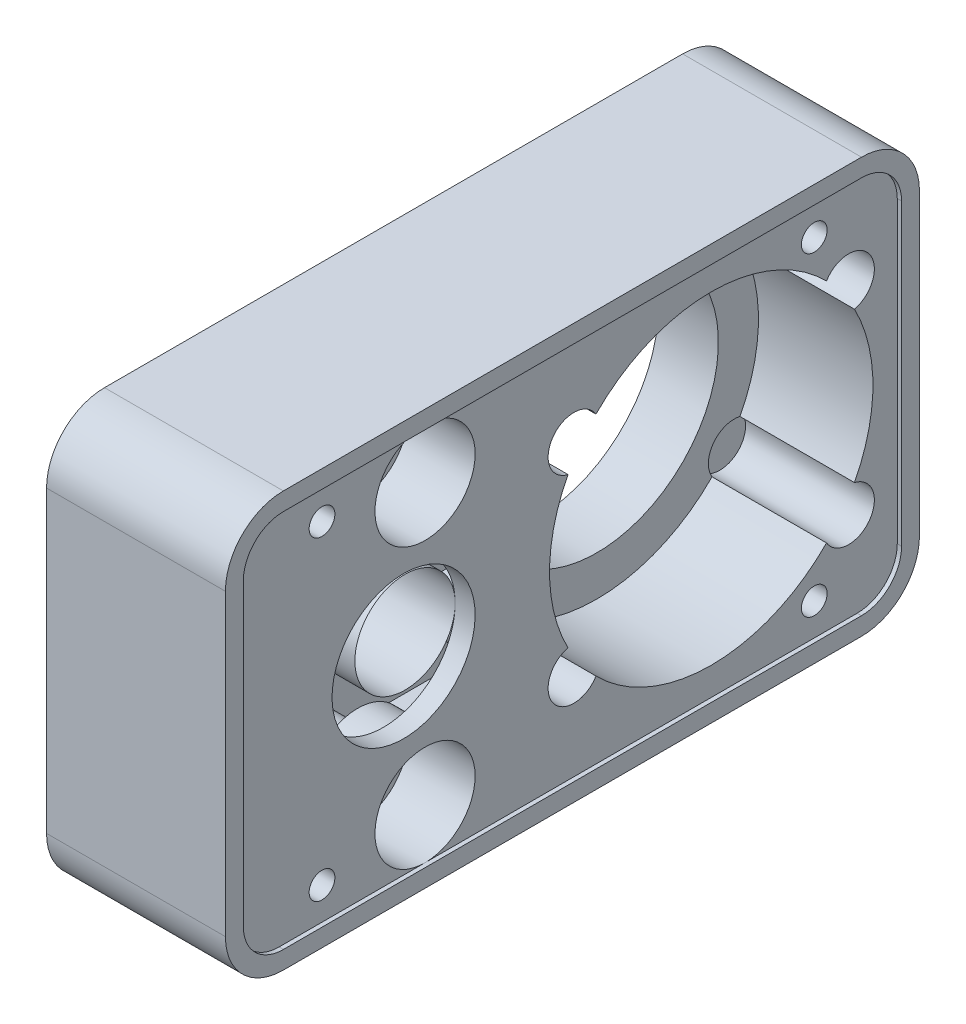
from build123d import *

# Parameters (mm, degrees)
SKETCH1_R             = 10.795
BOSS_EXTRUDE1_DEPTH   = 15.875
CAVITY1_START         = 5.334
CAVITY1_OUTLINE_R     = 1.143
CAVITY1_OUTLINE_R_2   = 4.445
CAVITY1_OUTLINE_R_3   = 10.795
CAVITY1_DEPTH         = 10.541
CAVITY1_START_2       = 15.494
CAVITY1_2_OUTLINE_R   = 1.143
CAVITY1_2_OUTLINE_R_2 = 4.445
CAVITY1_2_DEPTH       = 0.381
CAVITY1_START_3       = 2.286
CAVITY1_3_OUTLINE_R   = 1.143
CAVITY1_3_OUTLINE_R_2 = 4.445
CAVITY1_3_DEPTH       = 3.048
CAVITY1_4_OUTLINE_R   = 1.905
CAVITY1_4_DEPTH       = 3.302
CAVITY1_START_4       = 13.716
CAVITY1_5_DEPTH       = 1.778
CAVITY1_START_5       = 4.064
CAVITY1_6_OUTLINE_R   = 2.286
CAVITY1_6_DEPTH       = 1.27
CAVITY1_START_6       = 2.032
CAVITY1_7_DEPTH       = 0.254
CUT_EXTRUDE1_REACH    = 51.711
SKETCH2_R             = 2.286
SKETCH3_R             = 4.445
CUT_EXTRUDE2_DEPTH    = 5.969


# Read off the part's stored shape, not the designer's step: Cavity1
with BuildPart() as part:
    # Sketch1 → Boss-Extrude1 (new body)
    with BuildSketch(Plane(origin=(0, 0, 0), x_dir=(0, 0, -1), z_dir=(1, 0, 0))):
        with BuildLine():
            Line((12.954, 18.415), (-38.354, 18.415))
            ThreePointArc((-38.354, 18.415), (-41.991003729, 16.908503729), (-43.4975, 13.2715))
            Line((-43.4975, 13.2715), (-43.4975, -13.2715))
            ThreePointArc((-43.4975, -13.2715), (-41.991003729, -16.908503729), (-38.354, -18.415))
            Line((-38.354, -18.415), (12.954, -18.415))
            ThreePointArc((12.954, -18.415), (16.591003729, -16.908503729), (18.0975, -13.2715))
            Line((18.0975, -13.2715), (18.0975, 13.2715))
            ThreePointArc((18.0975, 13.2715), (16.591003729, 16.908503729), (12.954, 18.415))
        make_face()
        Circle(SKETCH1_R, mode=Mode.SUBTRACT)
    extrude(amount=BOSS_EXTRUDE1_DEPTH)

    # Cavity1 outline → Cavity1 (cut)
    # profile 1 of 6: a face of its own
    with BuildSketch(Plane.YZ.offset(CAVITY1_START)):
        with Locations((13.97, 34.544)):
            Circle(CAVITY1_OUTLINE_R)
    # profile 2 of 6: a face of its own
    with BuildSketch(Plane.YZ.offset(CAVITY1_START)):
        with Locations((0, 25.4)):
            Circle(CAVITY1_OUTLINE_R_2)
    # profile 3 of 6: a face of its own
    with BuildSketch(Plane.YZ.offset(CAVITY1_START)):
        with BuildLine():
            ThreePointArc((6.663505747, 12.710188518), (0, 14.351), (-6.663505747, 12.710188518))
            ThreePointArc((-6.663505747, 12.710188518), (-10.236847552, 14.039105214), (-10.064128852, 10.230567504))
            ThreePointArc((-10.064128852, 10.230567504), (-14.351, 0), (-10.064128852, -10.230567504))
            ThreePointArc((-10.064128852, -10.230567504), (-10.236847552, -14.039105214), (-6.663505747, -12.710188518))
            ThreePointArc((-6.663505747, -12.710188518), (0, -14.351), (6.663505747, -12.710188518))
            ThreePointArc((6.663505747, -12.710188518), (10.236847552, -14.039105214), (10.064128852, -10.230567504))
            ThreePointArc((10.064128852, -10.230567504), (14.351, 0), (10.064128852, 10.230567504))
            ThreePointArc((10.064128852, 10.230567504), (10.236847552, 14.039105214), (6.663505747, 12.710188518))
        make_face()
        Circle(CAVITY1_OUTLINE_R_3, mode=Mode.SUBTRACT)
    # profile 4 of 6: a face of its own
    with BuildSketch(Plane.YZ.offset(CAVITY1_START)):
        with Locations((13.97, -9.144)):
            Circle(CAVITY1_OUTLINE_R)
    # profile 5 of 6: a face of its own
    with BuildSketch(Plane.YZ.offset(CAVITY1_START)):
        with Locations((-13.97, 34.544)):
            Circle(CAVITY1_OUTLINE_R)
    # profile 6 of 6: a face of its own
    with BuildSketch(Plane.YZ.offset(CAVITY1_START)):
        with Locations((-13.97, -9.144)):
            Circle(CAVITY1_OUTLINE_R)
    extrude(amount=CAVITY1_DEPTH, mode=Mode.SUBTRACT)

    # Cavity1 2 outline → Cavity1 2 (cut)
    with BuildSketch(Plane.YZ.offset(CAVITY1_START_2)):
        with BuildLine():
            ThreePointArc((16.8275, 38.354), (15.785971714, 40.868471714), (13.2715, 41.91))
            Line((13.2715, 41.91), (-13.2715, 41.91))
            ThreePointArc((-13.2715, 41.91), (-15.785971714, 40.868471714), (-16.8275, 38.354))
            Line((-16.8275, 38.354), (-16.8275, -12.954))
            ThreePointArc((-16.8275, -12.954), (-15.785971714, -15.468471714), (-13.2715, -16.51))
            Line((-13.2715, -16.51), (13.2715, -16.51))
            ThreePointArc((13.2715, -16.51), (15.785971714, -15.468471714), (16.8275, -12.954))
            Line((16.8275, -12.954), (16.8275, 38.354))
        make_face()
        with Locations((13.97, 34.544)):
            Circle(CAVITY1_2_OUTLINE_R, mode=Mode.SUBTRACT)
        with BuildLine():
            ThreePointArc((10.064128852, 10.230567504), (14.351, 0), (10.064128852, -10.230567504))
            ThreePointArc((10.064128852, -10.230567504), (10.236847552, -14.039105214), (6.663505747, -12.710188518))
            ThreePointArc((6.663505747, -12.710188518), (0, -14.351), (-6.663505747, -12.710188518))
            ThreePointArc((-6.663505747, -12.710188518), (-10.236847552, -14.039105214), (-10.064128852, -10.230567504))
            ThreePointArc((-10.064128852, -10.230567504), (-14.351, 0), (-10.064128852, 10.230567504))
            ThreePointArc((-10.064128852, 10.230567504), (-10.236847552, 14.039105214), (-6.663505747, 12.710188518))
            ThreePointArc((-6.663505747, 12.710188518), (0, 14.351), (6.663505747, 12.710188518))
            ThreePointArc((6.663505747, 12.710188518), (10.236847552, 14.039105214), (10.064128852, 10.230567504))
        make_face(mode=Mode.SUBTRACT)
        with Locations((0, 25.4)):
            Circle(CAVITY1_2_OUTLINE_R_2, mode=Mode.SUBTRACT)
        with Locations((13.97, -9.144)):
            Circle(CAVITY1_2_OUTLINE_R, mode=Mode.SUBTRACT)
        with Locations((-13.97, 34.544)):
            Circle(CAVITY1_2_OUTLINE_R, mode=Mode.SUBTRACT)
        with Locations((-13.97, -9.144)):
            Circle(CAVITY1_2_OUTLINE_R, mode=Mode.SUBTRACT)
    extrude(amount=CAVITY1_2_DEPTH, mode=Mode.SUBTRACT)

    # Cavity1 3 outline → Cavity1 3 (cut)
    with BuildSketch(Plane.YZ.offset(CAVITY1_START_3)):
        with Locations((13.97, 34.544)):
            Circle(CAVITY1_3_OUTLINE_R)
        with Locations((0, 25.4)):
            Circle(CAVITY1_3_OUTLINE_R_2)
        with BuildLine():
            ThreePointArc((3.011692939, 10.366375), (3.7542861, 12.050819068), (3.62043784, 13.886815))
            ThreePointArc((3.62043784, 13.886815), (0, 14.351), (-3.62043784, 13.886815))
            ThreePointArc((-3.62043784, 13.886815), (-3.7542861, 12.050819068), (-3.011692939, 10.366375))
            ThreePointArc((-3.011692939, 10.366375), (0, 10.795), (3.011692939, 10.366375))
        make_face()
        with Locations((13.97, -9.144)):
            Circle(CAVITY1_3_OUTLINE_R)
        with Locations((-13.97, 34.544)):
            Circle(CAVITY1_3_OUTLINE_R)
        with Locations((-13.97, -9.144)):
            Circle(CAVITY1_3_OUTLINE_R)
    extrude(amount=CAVITY1_3_DEPTH, mode=Mode.SUBTRACT)

    # Cavity1 4 outline → Cavity1 4 (cut)
    with BuildSketch(Plane.YZ):
        with Locations((13.97, 34.544)):
            Circle(CAVITY1_4_OUTLINE_R)
        with Locations((13.97, -9.144)):
            Circle(CAVITY1_4_OUTLINE_R)
        with Locations((-13.97, 34.544)):
            Circle(CAVITY1_4_OUTLINE_R)
        with Locations((-13.97, -9.144)):
            Circle(CAVITY1_4_OUTLINE_R)
    extrude(amount=CAVITY1_4_DEPTH, mode=Mode.SUBTRACT)

    # Cavity1 5 outline → Cavity1 5 (cut)
    with BuildSketch(Plane.YZ.offset(CAVITY1_START_4)):
        with BuildLine():
            Line((4.32851275, 24.389058668), (6.269761763, 26.298725967))
            ThreePointArc((6.269761763, 26.298725967), (6.329908656, 26.800266009), (6.35, 27.305))
            ThreePointArc((6.35, 27.305), (5.350674614, 30.724470892), (2.667234274, 33.067669635))
            Line((2.667234274, 33.067669635), (1.522653349, 29.576068938))
            ThreePointArc((1.522653349, 29.576068938), (3.641855237, 27.948512396), (4.445, 25.4))
            ThreePointArc((4.445, 25.4), (4.41578216, 24.891184794), (4.32851275, 24.389058668))
        make_face()
        with BuildLine():
            ThreePointArc((1.261900966, 21.081648335), (4.581043617, 22.907666788), (6.269761763, 26.298725967))
            Line((6.269761763, 26.298725967), (4.32851275, 24.389058668))
            ThreePointArc((4.32851275, 24.389058668), (3.227510813, 22.343662494), (1.245086431, 21.132941906))
            Line((1.245086431, 21.132941906), (1.261900966, 21.081648335))
        make_face()
        with BuildLine():
            ThreePointArc((0.903307826, 21.019577582), (1.083049155, 21.048043509), (1.261900966, 21.081648335))
            Line((1.261900966, 21.081648335), (1.245086431, 21.132941906))
            ThreePointArc((1.245086431, 21.132941906), (1.093135949, 21.091510845), (0.939813075, 21.055488936))
            Line((0.939813075, 21.055488936), (0.903307826, 21.019577582))
        make_face()
        with BuildLine():
            ThreePointArc((3.3e-08, 20.955), (0.452806623, 20.971164972), (0.903307826, 21.019577582))
            Line((0.903307826, 21.019577582), (0.939813075, 21.055488936))
            ThreePointArc((0.939813075, 21.055488936), (0.472585099, 20.980193633), (3.3e-08, 20.955))
        make_face()
        with BuildLine():
            Line((1.522653349, 29.576068938), (2.667234274, 33.067669635))
            ThreePointArc((2.667234274, 33.067669635), (0, 33.655), (-2.667234274, 33.067669635))
            Line((-2.667234274, 33.067669635), (-1.522653349, 29.576068938))
            ThreePointArc((-1.522653349, 29.576068938), (0, 29.845), (1.522653349, 29.576068938))
        make_face()
        with BuildLine():
            ThreePointArc((-0.903307826, 21.019577582), (-0.45280659, 20.97116497), (3.3e-08, 20.955))
            ThreePointArc((3.3e-08, 20.955), (-0.472585066, 20.980193629), (-0.939813075, 21.055488936))
            Line((-0.939813075, 21.055488936), (-0.903307826, 21.019577582))
        make_face()
        with BuildLine():
            Line((-1.522653349, 29.576068938), (-2.667234274, 33.067669635))
            ThreePointArc((-2.667234274, 33.067669635), (-5.605544054, 30.288349771), (-6.269761763, 26.298725967))
            Line((-6.269761763, 26.298725967), (-4.32851275, 24.389058668))
            ThreePointArc((-4.32851275, 24.389058668), (-3.909642575, 27.514880596), (-1.522653349, 29.576068938))
        make_face()
        with BuildLine():
            ThreePointArc((-1.261900966, 21.081648335), (-1.083049155, 21.048043509), (-0.903307826, 21.019577582))
            Line((-0.903307826, 21.019577582), (-0.939813075, 21.055488936))
            ThreePointArc((-0.939813075, 21.055488936), (-1.093135949, 21.091510845), (-1.245086431, 21.132941906))
            Line((-1.245086431, 21.132941906), (-1.261900966, 21.081648335))
        make_face()
        with BuildLine():
            Line((-4.32851275, 24.389058668), (-6.269761763, 26.298725967))
            ThreePointArc((-6.269761763, 26.298725967), (-4.581043617, 22.907666788), (-1.261900966, 21.081648335))
            Line((-1.261900966, 21.081648335), (-1.245086431, 21.132941906))
            ThreePointArc((-1.245086431, 21.132941906), (-3.227510813, 22.343662494), (-4.32851275, 24.389058668))
        make_face()
    extrude(amount=CAVITY1_5_DEPTH, mode=Mode.SUBTRACT)

    # Cavity1 6 outline → Cavity1 6 (cut)
    with BuildSketch(Plane.YZ.offset(CAVITY1_START_5)):
        with Locations((8.89, 12.192)):
            Circle(CAVITY1_6_OUTLINE_R)
        with Locations((8.89, -12.192)):
            Circle(CAVITY1_6_OUTLINE_R)
        with Locations((-8.89, 12.192)):
            Circle(CAVITY1_6_OUTLINE_R)
        with Locations((-8.89, -12.192)):
            Circle(CAVITY1_6_OUTLINE_R)
    extrude(amount=CAVITY1_6_DEPTH, mode=Mode.SUBTRACT)

    # Cavity1 7 outline → Cavity1 7 (cut)
    with BuildSketch(Plane.YZ.offset(CAVITY1_START_6)):
        with BuildLine():
            ThreePointArc((3.011692939, 10.366375), (3.7542861, 12.050819068), (3.62043784, 13.886815))
            ThreePointArc((3.62043784, 13.886815), (0, 14.351), (-3.62043784, 13.886815))
            ThreePointArc((-3.62043784, 13.886815), (-3.7542861, 12.050819068), (-3.011692939, 10.366375))
            ThreePointArc((-3.011692939, 10.366375), (0, 10.795), (3.011692939, 10.366375))
        make_face()
    extrude(amount=CAVITY1_7_DEPTH, mode=Mode.SUBTRACT)

    # Sketch2 → Cut-Extrude1 (cut, up to next)
    with BuildSketch(Plane(origin=(15.494, 0, 0), x_dir=(0, 0, -1), z_dir=(1, 0, 0)), mode=Mode.PRIVATE) as cut_extrude1_sk1:
        with Locations((-25.4, 12.3825)):
            Circle(SKETCH2_R)
    cut_extrude1_tool1 = extrude(cut_extrude1_sk1.sketch, amount=-CUT_EXTRUDE1_REACH, mode=Mode.PRIVATE) & part.part
    # Sketch2 → Cut-Extrude1 (cut, up to next)
    with BuildSketch(Plane(origin=(15.494, 0, 0), x_dir=(0, 0, -1), z_dir=(1, 0, 0)), mode=Mode.PRIVATE) as cut_extrude1_sk2:
        with Locations((-25.4, -12.3825)):
            Circle(SKETCH2_R)
    cut_extrude1_tool2 = extrude(cut_extrude1_sk2.sketch, amount=-CUT_EXTRUDE1_REACH, mode=Mode.PRIVATE) & part.part
    add(cut_extrude1_tool1.solids().sort_by_distance((15.494, 12.3825, 25.4))[0], mode=Mode.SUBTRACT)
    add(cut_extrude1_tool2.solids().sort_by_distance((15.494, -12.3825, 25.4))[0], mode=Mode.SUBTRACT)

    # Sketch3 → Cut-Extrude2 (cut)
    with BuildSketch(Plane(origin=(15.494, 0, 0), x_dir=(0, 0, -1), z_dir=(1, 0, 0))):
        with Locations((-25.4, 12.3825)):
            Circle(SKETCH3_R)
        with Locations((-25.4, -12.3825)):
            Circle(SKETCH3_R)
    extrude(amount=-CUT_EXTRUDE2_DEPTH, mode=Mode.SUBTRACT)


solid = part.part
